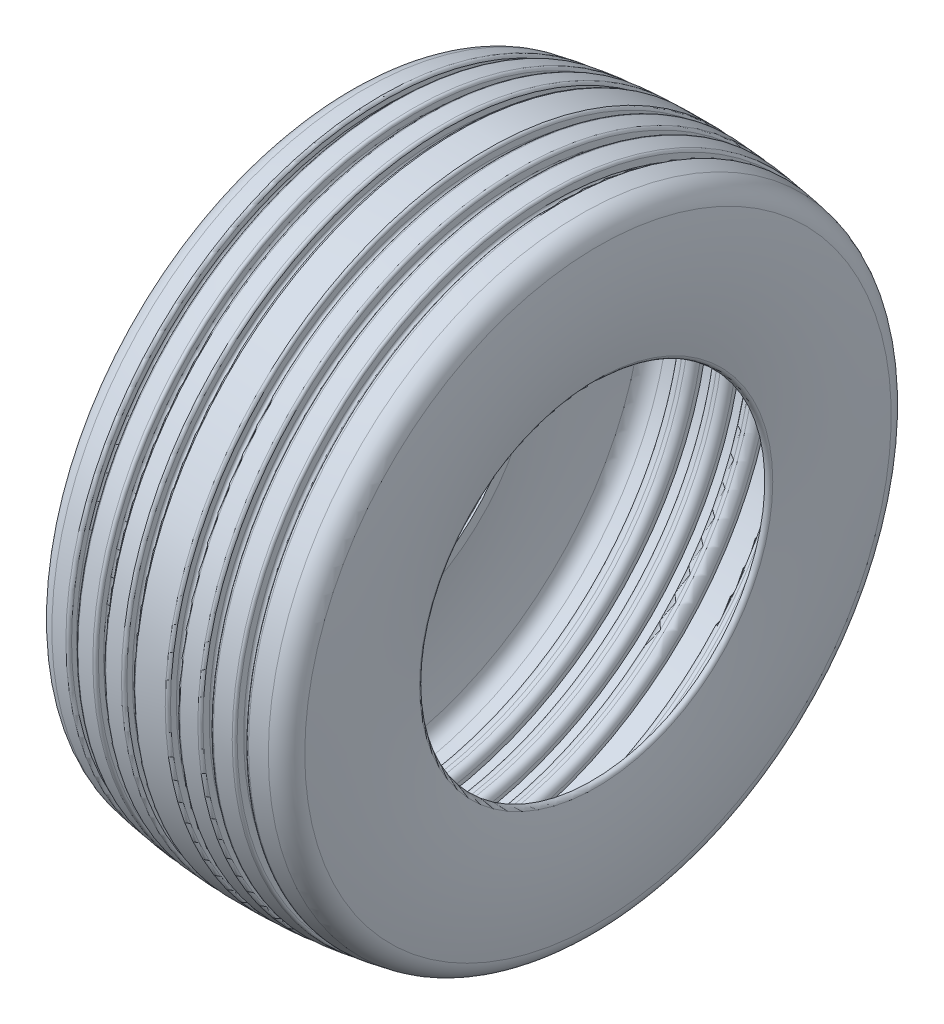
from build123d import *

# Parameters (mm, degrees)
CONG_1_R              = 50
CONG_2_R              = 10
CONG_3_R              = 6
CONG_4_R              = 6
CONG_3_OF_SYM_TRIE2_R = 6
CONG_4_OF_SYM_TRIE2_R = 6
ECHELLE1_SCALE        = 0.25


# Read off the part's stored shape, not the designer's step: Révolution3, Coque1
with BuildPart() as part:
    # Révolution3 outline → Révolution3 (revolve)
    with BuildSketch(Plane.YX):
        with BuildLine():
            ThreePointArc((700, -280), (730, 0), (700, 280))
            ThreePointArc((700, 280), (546, 293.679791101), (392, 280))
            Line((392, 280), (392, -280))
            ThreePointArc((392, -280), (546, -293.679791101), (700, -280))
        make_face()
    r_volution3 = revolve(axis=Axis((0, 0, 0), (1, 0, 0)))


with BuildPart() as sym_trie1_1:
    # Symétrie1: Révolution3 across plane
    add(r_volution3.mirror(Plane.XY))


with BuildPart() as part_1:
    add(part.part)

    # Symétrie1 united with what the copies to: union Symétrie1_1
    add(sym_trie1_1.part)

    # Congé1
    cong_1_edges = [part_1.edges().sort_by_distance(p)[0] for p in [
        (280, -700, 0),
        (-280, -700, 0),
    ]]
    fillet(cong_1_edges, radius=CONG_1_R)

    # Congé2
    cong_2_edges = [part_1.edges().sort_by_distance(p)[0] for p in [
        (-280, -392, 0),
        (280, -392, 0),
    ]]
    fillet(cong_2_edges, radius=CONG_2_R)

    # Esquisse3 → Enlèvement de matière-Révolution1 (revolve, cut)
    with BuildSketch(Plane.XY, mode=Mode.PRIVATE) as enl_vement_de_mati_re_r_volution1_sk:
        with BuildLine():
            ThreePointArc((-180, 717.685378346), (-190.005553524, 716.270895837), (-200, 714.779955962))
            Line((-200, 714.779955962), (-200, 689.482990651))
            ThreePointArc((-200, 689.482990651), (-190.005774489, 691.003302618), (-180, 692.445651024))
            Line((-180, 692.445651024), (-180, 717.685378346))
        make_face()
        with BuildLine():
            ThreePointArc((-110, 725.41449172), (-120.003463549, 724.540743476), (-130, 723.591018267))
            Line((-130, 723.591018267), (-130, 698.466832024))
            ThreePointArc((-130, 698.466832024), (-120.003599564, 699.435025895), (-110, 700.325765372))
            Line((-110, 700.325765372), (-110, 725.41449172))
        make_face()
        with BuildLine():
            ThreePointArc((-40, 729.394564987), (-50.001433299, 729.053831564), (-60, 728.637380808))
            Line((-60, 728.637380808), (-60, 703.611081326))
            ThreePointArc((-60, 703.611081326), (-50.001489186, 704.035573635), (-40, 704.38288657))
            Line((-40, 704.38288657), (-40, 729.394564987))
        make_face()
    enl_vement_de_mati_re_r_volution1 = revolve(enl_vement_de_mati_re_r_volution1_sk.sketch.rotate(Axis((0, 0, 0), (-1, 0, 0)), 90), axis=Axis((0, 0, 0), (-1, 0, 0)), mode=Mode.SUBTRACT)

    # Congé3
    cong_3_edges = [part_1.edges().sort_by_distance(p)[0] for p in [
        (-180, -717.685378346, 0),
        (-200, -714.779955962, 0),
        (-110, -725.41449172, 0),
        (-130, -723.591018267, 0),
        (-40, -729.394564987, 0),
        (-60, -728.637380808, 0),
    ]]
    fillet(cong_3_edges, radius=CONG_3_R)

    # Congé4
    cong_4_edges = [part_1.edges().sort_by_distance(p)[0] for p in [
        (-180, 0, 692.445651024),
        (-200, 0, 689.482990651),
        (-110, 0, 700.325765372),
        (-130, 0, 698.466832024),
        (-40, 0, 704.38288657),
        (-60, 0, 703.611081326),
    ]]
    fillet(cong_4_edges, radius=CONG_4_R)

    # Symétrie2: Enlèvement de matière-Révolution1 across plane
    add(enl_vement_de_mati_re_r_volution1.mirror(Plane(origin=(0, 0, 0), x_dir=(0, 0, 1), z_dir=(1, 0, 0))), mode=Mode.SUBTRACT)

    # Congé3 of Symétrie2
    cong_3_of_sym_trie2_edges = [part_1.edges().sort_by_distance(p)[0] for p in [
        (180, -717.685378346, 0),
        (200, -714.779955962, 0),
        (110, -725.41449172, 0),
        (130, -723.591018267, 0),
        (40, -729.394564987, 0),
        (60, -728.637380808, 0),
    ]]
    fillet(cong_3_of_sym_trie2_edges, radius=CONG_3_OF_SYM_TRIE2_R)

    # Congé4 of Symétrie2
    cong_4_of_sym_trie2_edges = [part_1.edges().sort_by_distance(p)[0] for p in [
        (180, 0, 692.445651024),
        (200, 0, 689.482990651),
        (110, 0, 700.325765372),
        (130, 0, 698.466832024),
        (40, 0, 704.38288657),
        (60, 0, 703.611081326),
    ]]
    fillet(cong_4_of_sym_trie2_edges, radius=CONG_4_OF_SYM_TRIE2_R)

    # Coque1 outline → Coque1 (revolve, cut)
    with BuildSketch(Plane.YX):
        with BuildLine():
            Line((414.526291569, 271.59054014), (392, 271.59054014))
            Line((392, 271.59054014), (392, -271.59054014))
            Line((392, -271.59054014), (414.526291569, -271.59054014))
            ThreePointArc((414.526291569, -271.59054014), (538.718897678, -281.64902779), (663.06375129, -273.690763764))
            ThreePointArc((663.06375129, -273.690763764), (684.085352011, -263.581939214), (695.240809637, -243.096534756))
            ThreePointArc((695.240809637, -243.096534756), (698.077896317, -227.564804025), (700.727537041, -212))
            Line((700.727537041, -212), (696.473249819, -212))
            ThreePointArc((696.473249819, -212), (682.830453346, -205.741980429), (678.673977688, -191.319344933))
            ThreePointArc((678.673977688, -191.319344933), (679.261678845, -187.375518731), (679.837136257, -183.42988741))
            ThreePointArc((679.837136257, -183.42988741), (685.868437277, -172.393714199), (697.652705888, -168))
            Line((697.652705888, -168), (707.180043988, -168))
            ThreePointArc((707.180043988, -168), (708.794550264, -155.007745084), (710.2790994, -142))
            Line((710.2790994, -142), (705.08483013, -142))
            ThreePointArc((705.08483013, -142), (691.764894862, -136.106994857), (687.166564821, -122.286591607))
            ThreePointArc((687.166564821, -122.286591607), (687.537583938, -118.342425531), (687.896438521, -114.397134084))
            ThreePointArc((687.896438521, -114.397134084), (693.676917933, -102.717462846), (705.824930395, -98))
            Line((705.824930395, -98), (714.328271217, -98))
            ThreePointArc((714.328271217, -98), (715.238480168, -85.00420552), (716.019372785, -72))
            Line((716.019372785, -72), (709.880276184, -72))
            ThreePointArc((709.880276184, -72), (696.891224815, -66.461321941), (691.895748315, -53.25383828))
            ThreePointArc((691.895748315, -53.25383828), (692.05333131, -49.309342324), (692.198792563, -45.364380757))
            ThreePointArc((692.198792563, -45.364380757), (697.686389494, -33.049302212), (710.187566512, -28))
            Line((710.187566512, -28), (717.700652987, -28))
            ThreePointArc((717.700652987, -28), (718, 0), (717.700652987, 28))
            Line((717.700652987, 28), (710.187566512, 28))
            ThreePointArc((710.187566512, 28), (697.686389494, 33.049302212), (692.198792563, 45.364380757))
            ThreePointArc((692.198792563, 45.364380757), (692.05333131, 49.309342324), (691.895748315, 53.25383828))
            ThreePointArc((691.895748315, 53.25383828), (696.891224815, 66.461321941), (709.880276184, 72))
            Line((709.880276184, 72), (716.019372785, 72))
            ThreePointArc((716.019372785, 72), (715.238480168, 85.00420552), (714.328271217, 98))
            Line((714.328271217, 98), (705.824930395, 98))
            ThreePointArc((705.824930395, 98), (693.676917933, 102.717462846), (687.896438521, 114.397134084))
            ThreePointArc((687.896438521, 114.397134084), (687.537583938, 118.342425531), (687.166564821, 122.286591607))
            ThreePointArc((687.166564821, 122.286591607), (691.764894862, 136.106994857), (705.08483013, 142))
            Line((705.08483013, 142), (710.2790994, 142))
            ThreePointArc((710.2790994, 142), (708.794550264, 155.007745084), (707.180043988, 168))
            Line((707.180043988, 168), (697.652705888, 168))
            ThreePointArc((697.652705888, 168), (685.868437277, 172.393714199), (679.837136257, 183.42988741))
            ThreePointArc((679.837136257, 183.42988741), (679.261678845, 187.375518731), (678.673977688, 191.319344933))
            ThreePointArc((678.673977688, 191.319344933), (682.830453346, 205.741980429), (696.473249819, 212))
            Line((696.473249819, 212), (700.727537041, 212))
            ThreePointArc((700.727537041, 212), (698.077896317, 227.564804025), (695.240809637, 243.096534756))
            ThreePointArc((695.240809637, 243.096534756), (684.085352011, 263.581939214), (663.06375129, 273.690763764))
            ThreePointArc((663.06375129, 273.690763764), (538.718897678, 281.64902779), (414.526291569, 271.59054014))
        make_face()
    revolve(axis=Axis((0, 0, 0), (1, 0, 0)), mode=Mode.SUBTRACT)


with BuildPart() as part_2:
    # Echelle1: scaled about (-3.135e-06, 7.202e-06, -3.039e-06)
    add(part_1.part.scale(ECHELLE1_SCALE).moved(Location((-2.351e-06, 5.401e-06, -2.279e-06))))


solid = part_2.part
